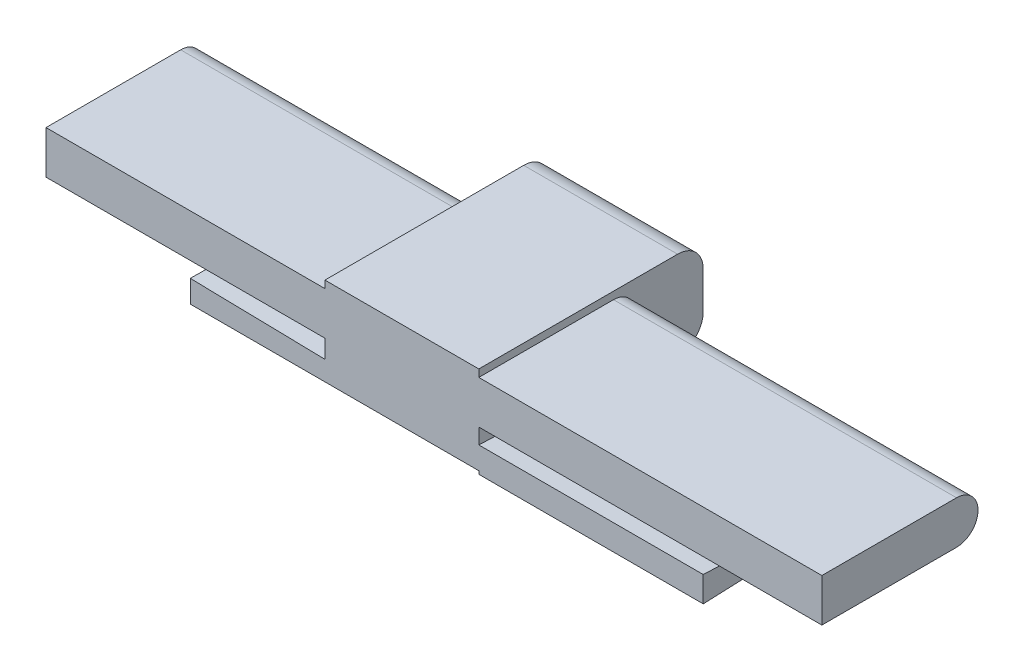
from build123d import *

# Parameters (mm, degrees)
BOSS_EXTRUDE1_DEPTH      = 48
BOSS_EXTRUDE2_DEPTH      = 107
BOSS_EXTRUDE2_DEPTH_BACK = 135
BOSS_EXTRUDE3_DEPTH      = 70


with BuildPart() as part:
    # Sketch6 → Boss-Extrude1 (new body)
    with BuildSketch(Plane.YZ):
        with BuildLine():
            Line((-18.5, 42), (9, 42))
            Line((9, 42), (9, -20))
            ThreePointArc((9, -20), (6.656854249, -25.656854249), (1, -28))
            Line((1, -28), (-10.5, -28))
            ThreePointArc((-10.5, -28), (-16.156854249, -25.656854249), (-18.5, -20))
            Line((-18.5, -20), (-18.5, 42))
        make_face()
    extrude(amount=-BOSS_EXTRUDE1_DEPTH)

    # Sketch7 → Boss-Extrude2 (add, two sides: drawn at the far end of the back side and taken through both)
    with BuildSketch(Plane.YZ.offset(-BOSS_EXTRUDE2_DEPTH_BACK)):
        with BuildLine():
            Line((6.7, 42), (6.7, 0))
            ThreePointArc((6.7, 0), (0, -6.7), (-6.7, 0))
            Line((-6.7, 0), (-6.7, 42))
            Line((-6.7, 42), (6.7, 42))
        make_face()
    extrude(amount=BOSS_EXTRUDE2_DEPTH + BOSS_EXTRUDE2_DEPTH_BACK)

    # Sketch8 → Boss-Extrude3 (add)
    with BuildSketch(Plane.YZ):
        with BuildLine():
            Line((-17.499999986, -6.99976205), (-19.468374717, 42))
            Line((-19.468374717, 42), (-11.531625283, 42))
            Line((-11.531625283, 42), (-13.500019034, -7.008725467))
            ThreePointArc((-13.500019034, -7.008725467), (-15.504481719, -8.999994979), (-17.499999986, -6.99976205))
        make_face()
    extrude(amount=BOSS_EXTRUDE3_DEPTH)

    # Loft2: read off the stored shape, not the designer's step
    # Loft2: loft between two sections, ruled curve by curve
    loft2_from = [
        Edge.make_bspline([(-43, -12.5, 42), (-43, -12.5, 36.250008881), (-43, -12.5, 24.641436529), (-43, -12.5, 7.145431099), (-43, -12.5, -10.177895331), (-43, -12.5, -21.457402798), (-43, -12.5, -27.496400477), (-43, -12.735353866, -28.366169962), (-43, -13.470979996, -29.306081404), (-43, -14.433479869, -29.873432167), (-43, -15.500002282, -30.063307511), (-43, -16.566524261, -29.873430596), (-43, -17.529022849, -29.306078761), (-43, -18.264647219, -28.36616736), (-43, -18.5, -27.496399176), (-43, -18.5, -21.457400197), (-43, -18.5, -10.177897954), (-43, -18.5, 7.145406937), (-43, -18.5, 24.641401673), (-43, -18.5, 36.249991119), (-43, -18.5, 42)], [0, 0, 0, 0, 0.114724944, 0.229449887, 0.344174831, 0.458899774, 0.458899774, 0.469174653, 0.479449533, 0.489724412, 0.499999291, 0.51027417, 0.52054905, 0.530823929, 0.541098808, 0.541098808, 0.655824106, 0.770549404, 0.885274702, 1, 1, 1, 1], 3),
        Edge.make_line((-43, -18.5, 42), (-43, -12.5, 42)),
    ]
    loft2_to = [
        Edge.make_bspline([(-90, -11.531625283, 42), (-90, -11.570656574, 37.916659954), (-90, -11.648004314, 29.824764413), (-90, -11.763499254, 17.742019914), (-90, -11.880008186, 5.553194479), (-90, -11.95947034, -2.759904881), (-90, -12, -7.379764452), (-90, -12.124025603, -8.182036975), (-90, -12.791211148, -9.362294599), (-90, -13.96862904, -10.268779081), (-90, -15.499994859, -10.616349391), (-90, -17.031362783, -10.268783245), (-90, -18.208784945, -9.362299724), (-90, -18.87597374, -8.182040057), (-90, -19, -7.379765435), (-90, -18.956733754, -2.759907847), (-90, -18.871906161, 5.553196207), (-90, -18.747530231, 17.742037363), (-90, -18.624236843, 29.824789377), (-90, -18.541666598, 37.916673379), (-90, -18.5, 42)], [0, 0, 0, 0, 0.114724944, 0.229449887, 0.344174831, 0.458899774, 0.458899774, 0.469174653, 0.479449533, 0.489724412, 0.499999291, 0.51027417, 0.52054905, 0.530823929, 0.541098808, 0.541098808, 0.655824106, 0.770549404, 0.885274702, 1, 1, 1, 1], 3),
        Edge.make_line((-90, -18.5, 42), (-90, -11.531625283, 42)),
    ]
    loft2 = Solid(Shell([*[Face.make_surface_from_curves(loft2_from[k], loft2_to[k]) for k in range(2)], Face(Wire(loft2_from)), Face(Wire(loft2_to))]))
    add(loft2)


solid = part.part
